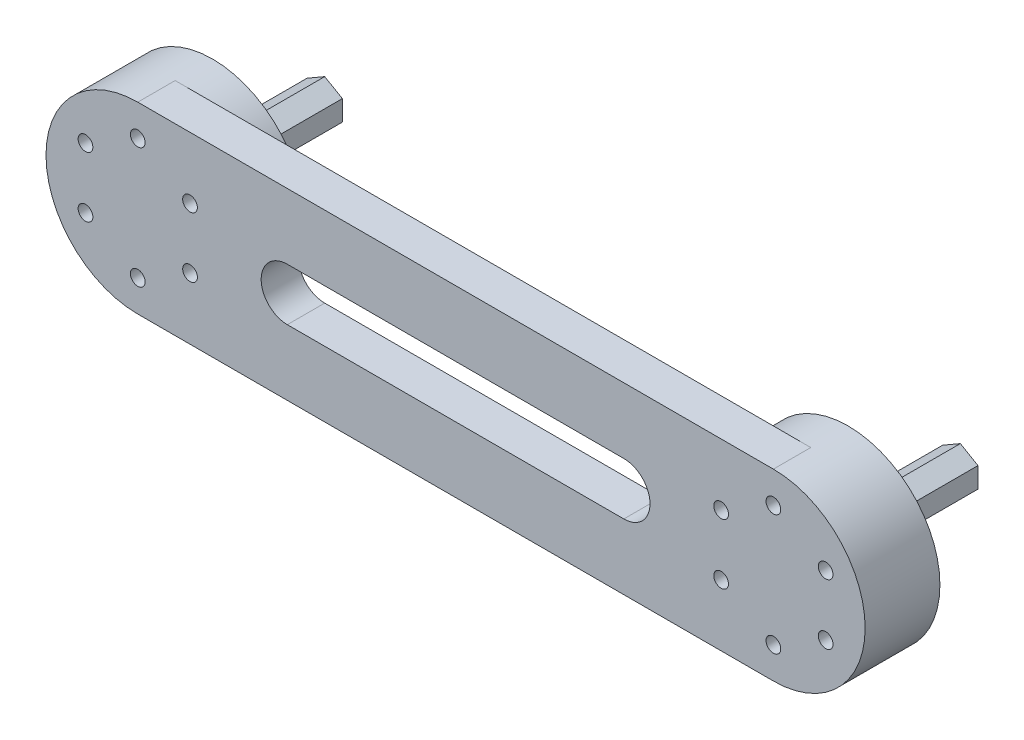
from build123d import *

# Parameters (mm, degrees)
SKETCH1_R                = 1.25
BOSS_EXTRUDE5_DEPTH      = 6.35
BOSS_EXTRUDE6_START      = -6.35
SKETCH1_7_R              = 15.584715873
SKETCH1_7_R_2            = 1.25
BOSS_EXTRUDE6_DEPTH      = 6.35
BOSS_EXTRUDE7_DEPTH      = 6.35
BOSS_EXTRUDE7_DEPTH_BACK = 25.4


with BuildPart() as part:
    # Sketch1 → Boss-Extrude5 (new body)
    with BuildSketch(Plane.XY):
        with BuildLine():
            Line((21.23324901, 27.290268066), (-86.71675099, 27.290268066))
            ThreePointArc((-86.71675099, 27.290268066), (-102.301466864, 11.705552193), (-86.71675099, -3.879163681))
            Line((-86.71675099, -3.879163681), (21.23324901, -3.879163681))
            ThreePointArc((21.23324901, -3.879163681), (36.817964883, 11.705552193), (21.23324901, 27.290268066))
        make_face()
        with BuildLine():
            ThreePointArc((-61.31675099, 7.260552193), (-65.76175099, 11.705552193), (-61.31675099, 16.150552193))
            Line((-61.31675099, 16.150552193), (-4.16675099, 16.150552193))
            ThreePointArc((-4.16675099, 16.150552193), (0.27824901, 11.705552193), (-4.16675099, 7.260552193))
            Line((-4.16675099, 7.260552193), (-61.31675099, 7.260552193))
        make_face(mode=Mode.SUBTRACT)
        with Locations((21.23324901, 21.955552193)):
            Circle(SKETCH1_R, mode=Mode.SUBTRACT)
        with Locations((21.23324901, 1.455552193)):
            Circle(SKETCH1_R, mode=Mode.SUBTRACT)
        with Locations((12.356488621, 6.580552193)):
            Circle(SKETCH1_R, mode=Mode.SUBTRACT)
        with Locations((30.110009399, 6.580552193)):
            Circle(SKETCH1_R, mode=Mode.SUBTRACT)
        Polygon((21.23324901, 15.169653808), (24.23324901, 13.437603), (24.23324901, 9.973501385), (21.23324901, 8.241450578), (18.23324901, 9.973501385), (18.23324901, 13.437603), align=None, mode=Mode.SUBTRACT)
        with Locations((12.356488621, 16.830552193)):
            Circle(SKETCH1_R, mode=Mode.SUBTRACT)
        with Locations((30.110009399, 16.830552193)):
            Circle(SKETCH1_R, mode=Mode.SUBTRACT)
        with Locations((-77.839990601, 16.830552193)):
            Circle(SKETCH1_R, mode=Mode.SUBTRACT)
        with Locations((-86.71675099, 21.955552193)):
            Circle(SKETCH1_R, mode=Mode.SUBTRACT)
        with Locations((-86.71675099, 1.455552193)):
            Circle(SKETCH1_R, mode=Mode.SUBTRACT)
        with Locations((-95.593511379, 6.580552193)):
            Circle(SKETCH1_R, mode=Mode.SUBTRACT)
        with Locations((-77.839990601, 6.580552193)):
            Circle(SKETCH1_R, mode=Mode.SUBTRACT)
        Polygon((-89.71675099, 13.437603), (-86.71675099, 15.169653808), (-83.71675099, 13.437603), (-83.71675099, 9.973501385), (-86.71675099, 8.241450578), (-89.71675099, 9.973501385), align=None, mode=Mode.SUBTRACT)
        with Locations((-95.593511379, 16.830552193)):
            Circle(SKETCH1_R, mode=Mode.SUBTRACT)
    extrude(amount=BOSS_EXTRUDE5_DEPTH)

    # Sketch1<7> → Boss-Extrude6 (add)
    # profile 1 of 2: a face of its own
    with BuildSketch(Plane.XY.offset(BOSS_EXTRUDE6_START)):
        with Locations((-86.71675099, 11.705552193)):
            Circle(SKETCH1_7_R)
        with Locations((-86.71675099, 1.455552193)):
            Circle(SKETCH1_7_R_2, mode=Mode.SUBTRACT)
        with Locations((-95.593511379, 6.580552193)):
            Circle(SKETCH1_7_R_2, mode=Mode.SUBTRACT)
        with Locations((-77.839990601, 6.580552193)):
            Circle(SKETCH1_7_R_2, mode=Mode.SUBTRACT)
        Polygon((-89.71675099, 13.437603), (-86.71675099, 15.169653808), (-83.71675099, 13.437603), (-83.71675099, 9.973501385), (-86.71675099, 8.241450578), (-89.71675099, 9.973501385), align=None, mode=Mode.SUBTRACT)
        with Locations((-95.593511379, 16.830552193)):
            Circle(SKETCH1_7_R_2, mode=Mode.SUBTRACT)
        with Locations((-77.839990601, 16.830552193)):
            Circle(SKETCH1_7_R_2, mode=Mode.SUBTRACT)
        with Locations((-86.71675099, 21.955552193)):
            Circle(SKETCH1_7_R_2, mode=Mode.SUBTRACT)
    # profile 2 of 2: a face of its own
    with BuildSketch(Plane.XY.offset(BOSS_EXTRUDE6_START)):
        with Locations((21.23324901, 11.705552193)):
            Circle(SKETCH1_7_R)
        with Locations((21.23324901, 1.455552193)):
            Circle(SKETCH1_7_R_2, mode=Mode.SUBTRACT)
        with Locations((12.356488621, 6.580552193)):
            Circle(SKETCH1_7_R_2, mode=Mode.SUBTRACT)
        with Locations((30.110009399, 6.580552193)):
            Circle(SKETCH1_7_R_2, mode=Mode.SUBTRACT)
        Polygon((21.23324901, 15.169653808), (24.23324901, 13.437603), (24.23324901, 9.973501385), (21.23324901, 8.241450578), (18.23324901, 9.973501385), (18.23324901, 13.437603), align=None, mode=Mode.SUBTRACT)
        with Locations((12.356488621, 16.830552193)):
            Circle(SKETCH1_7_R_2, mode=Mode.SUBTRACT)
        with Locations((30.110009399, 16.830552193)):
            Circle(SKETCH1_7_R_2, mode=Mode.SUBTRACT)
        with Locations((21.23324901, 21.955552193)):
            Circle(SKETCH1_7_R_2, mode=Mode.SUBTRACT)
    extrude(amount=BOSS_EXTRUDE6_DEPTH)

    # Sketch1<8> → Boss-Extrude7 (add, two sides: drawn at the far end of the back side and taken through both)
    with BuildSketch(Plane.XY.offset(-BOSS_EXTRUDE7_DEPTH_BACK)):
        Polygon((-86.71675099, 15.169653808), (-83.71675099, 13.437603), (-83.71675099, 9.973501385), (-86.71675099, 8.241450578), (-89.71675099, 9.973501385), (-89.71675099, 13.437603), align=None)
        Polygon((24.23324901, 13.437603), (21.23324901, 15.169653808), (18.23324901, 13.437603), (18.23324901, 9.973501385), (21.23324901, 8.241450578), (24.23324901, 9.973501385), align=None)
    extrude(amount=BOSS_EXTRUDE7_DEPTH + BOSS_EXTRUDE7_DEPTH_BACK)


solid = part.part
